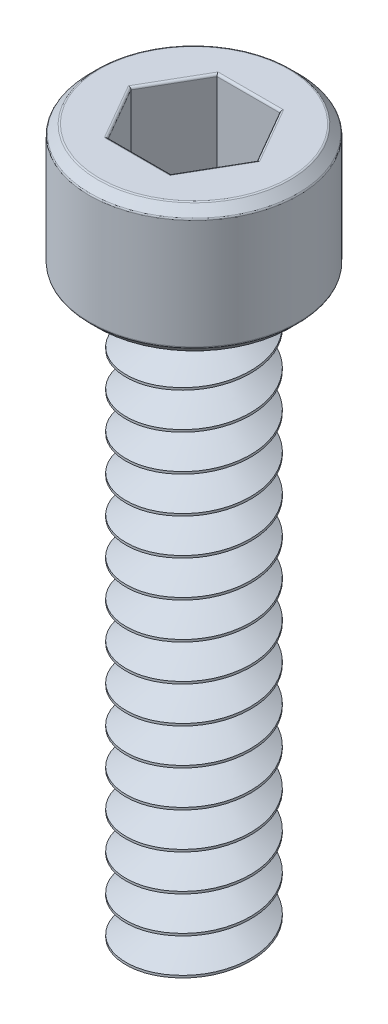
from build123d import *

# Parameters (mm, degrees)
CUT_EXTRUDE1_DEPTH = 2
CUT_SWEEP2_PITCH   = 0.8
FILLET1_R          = 0.05


with BuildPart() as part:
    # Sketch1 → Revolve1 (revolve)
    with BuildSketch(Plane.XY, mode=Mode.PRIVATE) as revolve1_sk:
        Polygon((0, 15.55), (2.1, 15.55), (2.3, 15.35), (2.3, 12.9), (2.1, 12.7), (1.375, 12.7), (1.375, 0), (0, 0), align=None)
    revolve(revolve1_sk.sketch.rotate(Axis((0, 0, 0), (0, 1, 0)), 90), axis=Axis((0, 0, 0), (0, 1, 0)))

    # Sketch2 → Cut-Extrude1 (cut)
    with BuildSketch(Plane(origin=(0, 15.55, 0), x_dir=(1, 0, 0), z_dir=(0, 1, 0))):
        Polygon((1.385640646, 0), (0.692820323, 1.2), (-0.692820323, 1.2), (-1.385640646, 0), (-0.692820323, -1.2), (0.692820323, -1.2), align=None)
    extrude(amount=-CUT_EXTRUDE1_DEPTH, mode=Mode.SUBTRACT)

    # Cut-Sweep2: arcs per turn and ends read off the stored shape
    # Cut-Sweep2: the profile of Sketch5 profile screwed along a right-hand helix through 17.25 turns, 8 arcs to a turn; built about Z, then put on its axis
    cut_sweep2_z = Axis((0, 0, 0), (0, 0, 1))
    cut_sweep2_corners = [(1.3753, 0, -0.800173205), (0.725480947, 0, -0.425), (1.3753, 0, -0.049826795)]
    with BuildLine(mode=Mode.PRIVATE) as cut_sweep2_profile:
        Line(cut_sweep2_corners[0], cut_sweep2_corners[1])
        Line(cut_sweep2_corners[1], cut_sweep2_corners[2])
        Line(cut_sweep2_corners[2], cut_sweep2_corners[0])
    cut_sweep2_cap = Face(cut_sweep2_profile.wire())
    cut_sweep2_turn_angles = [0, 22.5, 45, 67.5, 90, 112.5, 135, 157.5, 180, 202.5, 225, 247.5, 270, 292.5, 315, 337.5, 360]
    cut_sweep2_turn_weights = [1, 0.9238795325112867, 1, 0.9238795325112867, 1, 0.9238795325112867, 1, 0.9238795325112867, 1, 0.9238795325112867, 1, 0.9238795325112867, 1, 0.9238795325112867, 1, 0.9238795325112867, 1]
    cut_sweep2_turn_rails = [Edge.make_bspline([Vector(p[0], p[1], 0).rotate(cut_sweep2_z, cut_sweep2_turn_angles[k]) / cut_sweep2_turn_weights[k] + Vector(0, 0, p[2] + CUT_SWEEP2_PITCH * cut_sweep2_turn_angles[k] / 360) for k in range(17)], [0, 0, 0, 1, 1, 2, 2, 3, 3, 4, 4, 5, 5, 6, 6, 7, 7, 8, 8, 8], 2, cut_sweep2_turn_weights) for p in cut_sweep2_corners]
    cut_sweep2_turn_sides = [Face.make_surface_from_curves(cut_sweep2_turn_rails[p[0]], cut_sweep2_turn_rails[p[1]]) for p in [(0, 1), (1, 2), (2, 0)]]
    cut_sweep2_last_angles = [6120, 6142.5, 6165, 6187.5, 6210]
    cut_sweep2_last_weights = [1, 0.9238795325112867, 1, 0.9238795325112867, 1]
    cut_sweep2_last_rails = [Edge.make_bspline([Vector(p[0], p[1], 0).rotate(cut_sweep2_z, cut_sweep2_last_angles[k]) / cut_sweep2_last_weights[k] + Vector(0, 0, p[2] + CUT_SWEEP2_PITCH * cut_sweep2_last_angles[k] / 360) for k in range(5)], [0, 0, 0, 1, 1, 2, 2, 2], 2, cut_sweep2_last_weights) for p in cut_sweep2_corners]
    cut_sweep2_last_sides = [Face.make_surface_from_curves(cut_sweep2_last_rails[p[0]], cut_sweep2_last_rails[p[1]]) for p in [(0, 1), (1, 2), (2, 0)]]
    cut_sweep2 = Plane(origin=(0, 0, 0), x_dir=(-1, 0, 0), z_dir=(0, 1, 0)) * Solid(Shell([*[p.moved(Location((0, 0, CUT_SWEEP2_PITCH * i))) for i in range(17) for p in cut_sweep2_turn_sides], *cut_sweep2_last_sides, cut_sweep2_cap, cut_sweep2_cap.rotate(cut_sweep2_z, 6210).moved(Location((0, 0, CUT_SWEEP2_PITCH * 6210 / 360)))]))
    add(cut_sweep2, mode=Mode.SUBTRACT)

    # Fillet1
    fillet1_edges = [part.edges().sort_by_distance(p)[0] for p in [
        (1.039230485, 15.55, 0.6),
        (1.039230485, 15.55, -0.6),
        (0, 15.55, -1.2),
        (-1.039230485, 15.55, -0.6),
        (-1.039230485, 15.55, 0.6),
        (0, 15.55, 1.2),
        (0, 12.7, 2.1),
        (0, 12.9, 2.3),
        (0, 15.35, 2.3),
        (0, 15.55, 2.1),
    ]]
    fillet(fillet1_edges, radius=FILLET1_R)


solid = part.part
